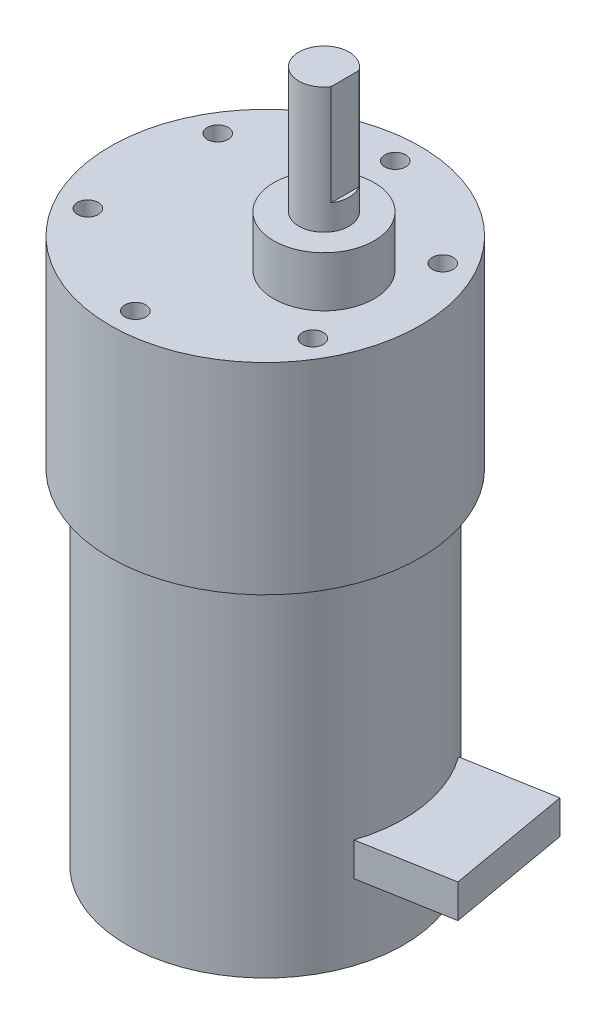
from build123d import *

# Parameters (mm, degrees)
SKETCH1_R           = 18.5
BOSS_EXTRUDE1_DEPTH = 24
SKETCH2_R           = 16.5
BOSS_EXTRUDE2_DEPTH = 41
SKETCH6_R           = 1.25
CUT_EXTRUDE1_DEPTH  = 3.5
SKETCH7_R           = 6
BOSS_EXTRUDE5_DEPTH = 6
SKETCH8_R           = 3
BOSS_EXTRUDE6_DEPTH = 15
CUT_EXTRUDE2_START  = -12
CUT_EXTRUDE2_DEPTH  = 12
SKETCH3_W           = 4
SKETCH3_H           = 15
BOSS_EXTRUDE4_DEPTH = 8.763


with BuildPart() as part:
    # Sketch1 → Boss-Extrude1 (new body)
    with BuildSketch(Plane(origin=(0, 0, 0), x_dir=(1, 0, 0), z_dir=(0, 1, 0))):
        Circle(SKETCH1_R)
    extrude(amount=BOSS_EXTRUDE1_DEPTH)

    # Sketch2 → Boss-Extrude2 (add)
    with BuildSketch(Plane.XZ):
        Circle(SKETCH2_R)
    extrude(amount=BOSS_EXTRUDE2_DEPTH)

    # Sketch6 → Cut-Extrude1 (cut)
    with BuildSketch(Plane(origin=(0, 24, 0), x_dir=(1, 0, 0), z_dir=(0, 1, 0))):
        with Locations((13.423393759, 7.75)):
            Circle(SKETCH6_R)
        with Locations((0, 15.5)):
            Circle(SKETCH6_R)
        with Locations((13.423393759, -7.75)):
            Circle(SKETCH6_R)
        with Locations((0, -15.5)):
            Circle(SKETCH6_R)
        with Locations((-13.423393759, -7.75)):
            Circle(SKETCH6_R)
        with Locations((-13.423393759, 7.75)):
            Circle(SKETCH6_R)
    extrude(amount=-CUT_EXTRUDE1_DEPTH, mode=Mode.SUBTRACT)

    # Sketch7 → Boss-Extrude5 (add)
    with BuildSketch(Plane(origin=(0, 24, 0), x_dir=(1, 0, 0), z_dir=(0, 1, 0))):
        with Locations((7, 0)):
            Circle(SKETCH7_R)
    extrude(amount=BOSS_EXTRUDE5_DEPTH)

    # Sketch8 → Boss-Extrude6 (add)
    with BuildSketch(Plane(origin=(0, 30, 0), x_dir=(1, 0, 0), z_dir=(0, 1, 0))):
        with Locations((7, 0)):
            Circle(SKETCH8_R)
    extrude(amount=BOSS_EXTRUDE6_DEPTH)

    # Sketch9 → Cut-Extrude2 (cut)
    with BuildSketch(Plane(origin=(0, 45, 0), x_dir=(1, 0, 0), z_dir=(0, 1, 0)).offset(CUT_EXTRUDE2_START)):
        with BuildLine():
            Line((9.5, 1.658312395), (9.5, -1.658312395))
            ThreePointArc((9.5, -1.658312395), (10, 0), (9.5, 1.658312395))
        make_face()
    extrude(amount=CUT_EXTRUDE2_DEPTH, mode=Mode.SUBTRACT)

    # Sketch3 → Boss-Extrude4 (add, symmetric)
    with BuildSketch(Plane(origin=(16.249327925, 0, -2.865194932), x_dir=(0, 1, 0), z_dir=(0.984807753012208, 0, -0.17364817766693072))):
        with Locations((-30, 0.254363191)):
            Rectangle(SKETCH3_W, SKETCH3_H)
    extrude(amount=BOSS_EXTRUDE4_DEPTH, both=True)


solid = part.part
